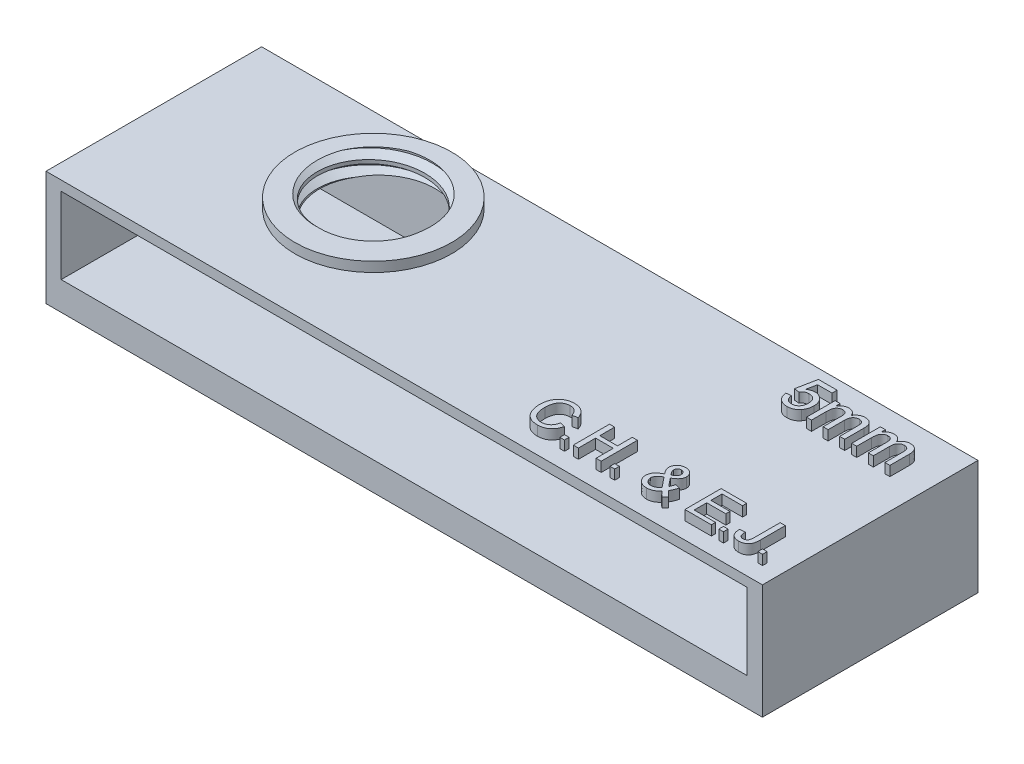
from build123d import *

# Parameters (mm, degrees)
SKIZZE1_W                       = 73.1
SKIZZE1_H                       = 22
BASIS_DEPTH                     = 11.7
SKIZZE2_W                       = 70
SKIZZE2_H                       = 7.8
HANDYSCHLITZ_DEPTH              = 21.25
SKIZZE3_R                       = 6.3
ZYLINDER_DEPTH                  = 1
SKIZZE6_R                       = 8
AUFSATZ_LINEAR_AUSTRAGEN1_DEPTH = 1
SKIZZE8_R                       = 6.3
SCHNITT_LINEAR_AUSTRAGEN2_DEPTH = 6
GEWINDE2_PITCH                  = 1.5
SKIZZE12_R                      = 7.5
SCHNITT_LINEAR_AUSTRAGEN5_DEPTH = 6
SKIZZE17_W                      = 30.300932881
SKIZZE17_H                      = 16.269400137
SCHNITT_LINEAR_AUSTRAGEN7_DEPTH = 6
EAH_JENA_DEPTH                  = 1
LOGO_DEPTH                      = 1
SKIZZE26_W                      = 0.474358974
SKIZZE26_H                      = 0.474358974
SKIZZE26_W_2                    = 0.474358975
C_H_E_J_DEPTH                   = 1
F_5MM_DEPTH                     = 1


with BuildPart() as part:
    # Skizze1 → Basis (new body)
    with BuildSketch(Plane(origin=(0, 0, 0), x_dir=(1, 0, 0), z_dir=(0, 1, 0))):
        with Locations((-9.866464149, 7.203333333)):
            Rectangle(SKIZZE1_W, SKIZZE1_H)
    extrude(amount=BASIS_DEPTH)

    # Skizze2 → Handyschlitz (cut)
    with BuildSketch(Plane.XY.offset(3.796666667)):
        with Locations((-9.866464149, 6.8)):
            Rectangle(SKIZZE2_W, SKIZZE2_H)
    extrude(amount=-HANDYSCHLITZ_DEPTH, mode=Mode.SUBTRACT)

    # Skizze3 → Zylinder (add)
    with BuildSketch(Plane(origin=(0, 11.7, 0), x_dir=(1, 0, 0), z_dir=(0, 1, 0))):
        with Locations(Location((-26.416464149, 9.603333333, 0), (0, 0, 270))):
            Circle(SKIZZE3_R)
    extrude(amount=ZYLINDER_DEPTH)

    # Skizze6 → Aufsatz-Linear austragen1 (add)
    with BuildSketch(Plane(origin=(0, 11.7, 0), x_dir=(1, 0, 0), z_dir=(0, 1, 0))):
        with Locations(Location((-26.416464149, 9.603333333, 0), (0, 0, 270))):
            Circle(SKIZZE6_R)
    extrude(amount=AUFSATZ_LINEAR_AUSTRAGEN1_DEPTH)

    # Skizze8 → Schnitt-Linear austragen2 (cut)
    with BuildSketch(Plane(origin=(0, 12.7, 0), x_dir=(1, 0, 0), z_dir=(0, 1, 0))):
        with Locations(Location((-26.416464149, 9.603333333, 0), (0, 0, 270))):
            Circle(SKIZZE8_R)
    extrude(amount=-SCHNITT_LINEAR_AUSTRAGEN2_DEPTH, mode=Mode.SUBTRACT)

    # Gewinde2: the profile of Gewindeprofil2 profile screwed along a right-hand helix of 5.333333 turns, 8 arcs to a turn; built about Z, then put on its axis
    gewinde2_z = Axis((0, 0, 0), (0, 0, 1))
    gewinde2_corners = [(6.3003, 0, -0.000173205), (6.3003, 0, 1.312673201), (5.488101187, 0, 0.843749998), (5.488101187, 0, 0.468749998)]
    with BuildLine(mode=Mode.PRIVATE) as gewinde2_profile:
        Line(gewinde2_corners[0], gewinde2_corners[1])
        Line(gewinde2_corners[1], gewinde2_corners[2])
        Line(gewinde2_corners[2], gewinde2_corners[3])
        Line(gewinde2_corners[3], gewinde2_corners[0])
    gewinde2_cap = Face(gewinde2_profile.wire())
    gewinde2_turn_angles = [0, 22.5, 45, 67.5, 90, 112.5, 135, 157.5, 180, 202.5, 225, 247.5, 270, 292.5, 315, 337.5, 360]
    gewinde2_turn_weights = [1, 0.9238795325112867, 1, 0.9238795325112867, 1, 0.9238795325112867, 1, 0.9238795325112867, 1, 0.9238795325112867, 1, 0.9238795325112867, 1, 0.9238795325112867, 1, 0.9238795325112867, 1]
    gewinde2_turn_rails = [Edge.make_bspline([Vector(p[0], p[1], 0).rotate(gewinde2_z, gewinde2_turn_angles[k]) / gewinde2_turn_weights[k] + Vector(0, 0, p[2] + GEWINDE2_PITCH * gewinde2_turn_angles[k] / 360) for k in range(17)], [0, 0, 0, 1, 1, 2, 2, 3, 3, 4, 4, 5, 5, 6, 6, 7, 7, 8, 8, 8], 2, gewinde2_turn_weights) for p in gewinde2_corners]
    gewinde2_turn_sides = [Face.make_surface_from_curves(gewinde2_turn_rails[p[0]], gewinde2_turn_rails[p[1]]) for p in [(0, 1), (1, 2), (2, 3), (3, 0)]]
    gewinde2_last_angles = [1800, 1822.5, 1845, 1867.5, 1890, 1905, 1920]
    gewinde2_last_weights = [1, 0.9238795325112867, 1, 0.9238795325112867, 1, 0.9659258262890688, 1]
    gewinde2_last_rails = [Edge.make_bspline([Vector(p[0], p[1], 0).rotate(gewinde2_z, gewinde2_last_angles[k]) / gewinde2_last_weights[k] + Vector(0, 0, p[2] + GEWINDE2_PITCH * gewinde2_last_angles[k] / 360) for k in range(7)], [0, 0, 0, 1, 1, 2, 2, 3, 3, 3], 2, gewinde2_last_weights) for p in gewinde2_corners]
    gewinde2_last_sides = [Face.make_surface_from_curves(gewinde2_last_rails[p[0]], gewinde2_last_rails[p[1]]) for p in [(0, 1), (1, 2), (2, 3), (3, 0)]]
    gewinde2 = Plane(origin=(-26.416464149, 14.3, -9.603333333), x_dir=(-1, 0, 0), z_dir=(0, -1, 0)) * Solid(Shell([*[p.moved(Location((0, 0, GEWINDE2_PITCH * i))) for i in range(5) for p in gewinde2_turn_sides], *gewinde2_last_sides, gewinde2_cap, gewinde2_cap.rotate(gewinde2_z, 1920).moved(Location((0, 0, GEWINDE2_PITCH * 1920 / 360)))]))
    add(gewinde2)

    # Skizze12 → Schnitt-Linear austragen5 (cut)
    with BuildSketch(Plane(origin=(0, 12.7, 0), x_dir=(1, 0, 0), z_dir=(0, 1, 0))):
        with Locations((-26.416464149, 9.603333333)):
            Circle(SKIZZE12_R)
    extrude(amount=SCHNITT_LINEAR_AUSTRAGEN5_DEPTH, mode=Mode.SUBTRACT)

    # Skizze17 → Schnitt-Linear austragen7 (cut)
    with BuildSketch(Plane(origin=(0, 10.7, 0), x_dir=(-1, 0, 0), z_dir=(0, -1, 0))):
        with Locations((28.531838804, 8.134700069)):
            Rectangle(SKIZZE17_W, SKIZZE17_H)
    extrude(amount=SCHNITT_LINEAR_AUSTRAGEN7_DEPTH, mode=Mode.SUBTRACT)

    # Skizze25 → EAH Jena (add)
    # profile 1 of 7: a face of its own
    with BuildSketch(Plane(origin=(0, 0, 0), x_dir=(-1, 0, 0), z_dir=(0, -1, 0))):
        Polygon((6.791710178, -1.663041856), (6.791710178, 1.836958144), (9.259658895, 1.836958144), (9.259658895, 1.43311199), (7.285299921, 1.43311199), (7.285299921, 0.356188913), (9.125043511, 0.356188913), (9.125043511, -0.047657241), (7.285299921, -0.047657241), (7.285299921, -1.259195702), (9.349402485, -1.259195702), (9.349402485, -1.663041856), align=None)
    # profile 2 of 7: a face of its own
    with BuildSketch(Plane(origin=(0, 0, 0), x_dir=(-1, 0, 0), z_dir=(0, -1, 0))):
        Polygon((9.543613222, -1.663041856), (10.93323662, 1.836958144), (11.489927325, 1.836958144), (12.879550722, -1.663041856), (12.355812742, -1.663041856), (11.957575562, -0.586118779), (10.465588383, -0.586118779), (10.067351203, -1.663041856), align=None)
        with BuildLine():
            Line((10.614226203, -0.182272625), (11.808937742, -0.182272625))
            Line((11.808937742, -0.182272625), (11.468893671, 0.737599169))
            add(Edge.make_bspline(
                [(11.468893671, 0.737599169), (11.455857596, 0.773141762), (11.430369606, 0.842634241), (11.392359336, 0.943600948), (11.357633765, 1.039483076), (11.323582491, 1.128905814), (11.292843798, 1.213168117), (11.264511156, 1.291700831), (11.236490413, 1.363958117), (11.219674771, 1.410643768), (11.211581972, 1.43311199)],
                knots=[0, 0, 0, 0, 1.225184869, 2.395467751, 3.491410812, 4.525364584, 5.492066482, 6.394148129, 7.227157926, 8, 8, 8, 8], degree=3))
            add(Edge.make_bspline(
                [(11.211581972, 1.43311199), (11.198194921, 1.377707334), (11.171365621, 1.266669571), (11.115191597, 1.103984353), (11.050930465, 0.942786964), (10.998742768, 0.838912467), (10.97249944, 0.786677695)],
                knots=[0, 0, 0, 0, 0.9891762, 1.982431084, 2.985436691, 4, 4, 4, 4], degree=3))
            Line((10.97249944, 0.786677695), (10.614226203, -0.182272625))
        make_face(mode=Mode.SUBTRACT)
    # profile 3 of 7: a face of its own
    with BuildSketch(Plane(origin=(0, 0, 0), x_dir=(-1, 0, 0), z_dir=(0, -1, 0))):
        Polygon((13.253248639, -1.663041856), (13.253248639, 1.836958144), (13.746838383, 1.836958144), (13.746838383, 0.401060708), (15.451966588, 0.401060708), (15.451966588, 1.836958144), (15.945556331, 1.836958144), (15.945556331, -1.663041856), (15.451966588, -1.663041856), (15.451966588, -0.002785446), (13.746838383, -0.002785446), (13.746838383, -1.663041856), align=None)
    # profile 4 of 7: a face of its own
    with BuildSketch(Plane(origin=(0, 0, 0), x_dir=(-1, 0, 0), z_dir=(0, -1, 0))):
        with BuildLine():
            Line((17.830171716, -0.686379196), (18.32376146, -0.630990574))
            add(Edge.make_bspline(
                [(18.32376146, -0.630990574), (18.325095054, -0.662092888), (18.327646186, -0.721590801), (18.336104163, -0.807008212), (18.347911279, -0.884697448), (18.36253253, -0.954942231), (18.379565969, -1.017791317), (18.400937234, -1.072737648), (18.423953924, -1.120935667), (18.452253265, -1.16088606), (18.482595025, -1.195029748), (18.515973611, -1.224020964), (18.55195843, -1.248725405), (18.590477759, -1.269133188), (18.631964985, -1.28478687), (18.67598885, -1.295660465), (18.722912253, -1.30318799), (18.755153505, -1.303768279), (18.771778286, -1.304067497)],
                knots=[0, 0, 0, 0, 1.632619403, 3.123158228, 4.499702462, 5.75227728, 6.885496867, 7.90993266, 8.841891104, 9.678429245, 10.468404694, 11.232957398, 11.991194639, 12.753385178, 13.513799276, 14.310593147, 15.128879333, 16, 16, 16, 16], degree=3))
            add(Edge.make_bspline(
                [(18.771778286, -1.304067497), (18.795948594, -1.303258637), (18.843177355, -1.301678124), (18.910921454, -1.28543416), (18.974042611, -1.261062533), (19.030755547, -1.22547634), (19.081319043, -1.182174894), (19.124329594, -1.131076481), (19.157092165, -1.072023015), (19.177726711, -1.017500544), (19.190384105, -0.968972917), (19.198667701, -0.926815945), (19.205651202, -0.879785295), (19.210925971, -0.827586205), (19.216281114, -0.770370123), (19.218420462, -0.70788694), (19.220914052, -0.64059173), (19.221100747, -0.594067985), (19.221197357, -0.569992978)],
                knots=[0, 0, 0, 0, 1.177507829, 2.300849353, 3.381033894, 4.466744326, 5.550475886, 6.619462111, 7.707386998, 8.830091395, 9.455333453, 10.153234525, 10.925888378, 11.774835866, 12.713513529, 13.729654905, 14.82514671, 16, 16, 16, 16], degree=3))
            Line((19.221197357, -0.569992978), (19.221197357, 1.836958144))
            Line((19.221197357, 1.836958144), (19.714787101, 1.836958144))
            Line((19.714787101, 1.836958144), (19.714787101, -0.538442497))
            add(Edge.make_bspline(
                [(19.714787101, -0.538442497), (19.714585465, -0.573971391), (19.714195247, -0.64272918), (19.709274699, -0.742842863), (19.70071679, -0.83682133), (19.689966548, -0.924870761), (19.675220284, -1.006805068), (19.656977905, -1.082350925), (19.636304717, -1.152121748), (19.603857092, -1.235394111), (19.554453955, -1.329868022), (19.478858362, -1.430064774), (19.387489561, -1.515539903), (19.281383393, -1.585889093), (19.163086158, -1.640180619), (19.034637285, -1.679598823), (18.896333766, -1.703992263), (18.800627436, -1.706582551), (18.751445754, -1.707913651)],
                knots=[0, 0, 0, 0, 0.979376435, 1.895351937, 2.762129694, 3.580429744, 4.339931879, 5.055623694, 5.722093767, 6.344240595, 7.517202841, 8.648554164, 9.788057829, 10.949533591, 12.142879013, 13.363546981, 14.645176409, 16, 16, 16, 16], degree=3))
            add(Edge.make_bspline(
                [(18.751445754, -1.707913651), (18.714948055, -1.707116316), (18.643854654, -1.705563197), (18.540496883, -1.693216986), (18.443373338, -1.674648981), (18.353691663, -1.644782191), (18.269632392, -1.609837507), (18.192822629, -1.564925889), (18.121947614, -1.513107367), (18.058801793, -1.452160372), (18.0018615, -1.384064763), (17.954778148, -1.306698621), (17.913168703, -1.222861112), (17.88175556, -1.130217094), (17.855988431, -1.03048475), (17.840050493, -0.922391611), (17.82958188, -0.80694885), (17.829971513, -0.727303214), (17.830171716, -0.686379196)],
                knots=[0, 0, 0, 0, 1.110149412, 2.162445788, 3.163771351, 4.112774839, 5.033433762, 5.928696445, 6.813333667, 7.698542325, 8.592646346, 9.506220098, 10.44759987, 11.434914499, 12.476633792, 13.577933972, 14.755478919, 16, 16, 16, 16], degree=3))
        make_face()
    # profile 5 of 7: a face of its own
    with BuildSketch(Plane(origin=(0, 0, 0), x_dir=(-1, 0, 0), z_dir=(0, -1, 0))):
        Polygon((20.522479408, -1.663041856), (20.522479408, 1.836958144), (22.990428126, 1.836958144), (22.990428126, 1.43311199), (21.016069152, 1.43311199), (21.016069152, 0.356188913), (22.855812742, 0.356188913), (22.855812742, -0.047657241), (21.016069152, -0.047657241), (21.016069152, -1.259195702), (23.080171716, -1.259195702), (23.080171716, -1.663041856), align=None)
    # profile 6 of 7: a face of its own
    with BuildSketch(Plane(origin=(0, 0, 0), x_dir=(-1, 0, 0), z_dir=(0, -1, 0))):
        Polygon((23.753248639, -1.663041856), (23.753248639, 1.836958144), (24.274883254, 1.836958144), (25.951966588, -0.774720542), (25.951966588, 1.836958144), (26.445556331, 1.836958144), (26.445556331, -1.663041856), (25.923921716, -1.663041856), (24.246838383, 0.94863683), (24.246838383, -1.663041856), align=None)
    # profile 7 of 7: a face of its own
    with BuildSketch(Plane(origin=(0, 0, 0), x_dir=(-1, 0, 0), z_dir=(0, -1, 0))):
        Polygon((26.774382453, -1.663041856), (28.164005851, 1.836958144), (28.720696556, 1.836958144), (30.110319953, -1.663041856), (29.586581972, -1.663041856), (29.188344793, -0.586118779), (27.696357613, -0.586118779), (27.298120434, -1.663041856), align=None)
        with BuildLine():
            Line((27.844995434, -0.182272625), (29.039706972, -0.182272625))
            Line((29.039706972, -0.182272625), (28.699662902, 0.737599169))
            add(Edge.make_bspline(
                [(28.699662902, 0.737599169), (28.686626826, 0.773141762), (28.661138837, 0.842634241), (28.623128566, 0.943600948), (28.588402995, 1.039483076), (28.554351722, 1.128905814), (28.523613028, 1.213168117), (28.495280387, 1.291700831), (28.467259644, 1.363958117), (28.450444002, 1.410643768), (28.442351203, 1.43311199)],
                knots=[0, 0, 0, 0, 1.225184869, 2.395467751, 3.491410812, 4.525364584, 5.492066482, 6.394148129, 7.227157926, 8, 8, 8, 8], degree=3))
            add(Edge.make_bspline(
                [(28.442351203, 1.43311199), (28.428964152, 1.377707334), (28.402134851, 1.266669571), (28.345960828, 1.103984353), (28.281699695, 0.942786964), (28.229511999, 0.838912467), (28.203268671, 0.786677695)],
                knots=[0, 0, 0, 0, 0.9891762, 1.982431084, 2.985436691, 4, 4, 4, 4], degree=3))
            Line((28.203268671, 0.786677695), (27.844995434, -0.182272625))
        make_face(mode=Mode.SUBTRACT)
    extrude(amount=EAH_JENA_DEPTH)

    # Skizze24 → LOGO (add)
    with BuildSketch(Plane(origin=(0, 0, 0), x_dir=(-1, 0, 0), z_dir=(0, -1, 0))):
        Polygon((33.761487263, 1.43405578), (32.029436456, -1.56594422), (35.493538071, -1.56594422), align=None)
        Polygon((35.947767039, -1.538115831), (37.679817846, 1.461884169), (34.215716231, 1.461884169), align=None)
        Polygon((38.093112145, 1.43405578), (36.361061337, -1.56594422), (39.825162952, -1.56594422), align=None)
        Polygon((40.238164925, -1.538115831), (41.970215732, 1.461884169), (38.506114117, 1.461884169), align=None)
        Polygon((42.342197995, 1.43405578), (40.610147188, -1.56594422), (44.074248803, -1.56594422), align=None)
        Polygon((35.947458768, 4.854602398), (34.21540796, 1.854602398), (37.679509575, 1.854602398), align=None)
        Polygon((38.133781063, 1.93405578), (39.865831871, 4.93405578), (36.401730256, 4.93405578), align=None)
        Polygon((40.279078334, 4.854602398), (38.547027526, 1.854602398), (42.011129142, 1.854602398), align=None)
        Polygon((38.133781063, 8.331557422), (36.401730256, 5.331557422), (39.865831871, 5.331557422), align=None)
    extrude(amount=LOGO_DEPTH)

    # Skizze26 → C.H. & E.J. (add)
    # profile 1 of 9: a face of its own
    with BuildSketch(Plane(origin=(0, 11.7, 0), x_dir=(1, 0, 0), z_dir=(0, 1, 0))):
        with BuildLine():
            Line((3.075711078, -0.786637436), (3.59750595, -0.908191923))
            add(Edge.make_bspline(
                [(3.59750595, -0.908191923), (3.584433532, -0.957098307), (3.55886226, -1.052765264), (3.508304748, -1.189675268), (3.451560142, -1.318159468), (3.38725156, -1.437879412), (3.31467515, -1.548146786), (3.235753894, -1.650378737), (3.147361833, -1.742431365), (3.052742176, -1.826429196), (2.951158207, -1.90051506), (2.843834679, -1.964489562), (2.731290373, -2.018918877), (2.613070418, -2.063678204), (2.489098172, -2.097363435), (2.36001197, -2.121915204), (2.225435405, -2.137037665), (2.133703404, -2.139028581), (2.086969091, -2.140042885)],
                knots=[0, 0, 0, 0, 1.145254194, 2.240259345, 3.299159039, 4.322497661, 5.312016644, 6.284080175, 7.241264552, 8.196044782, 9.144516039, 10.082428046, 11.020306713, 11.970622414, 12.939253955, 13.924100776, 14.94240044, 16, 16, 16, 16], degree=3))
            add(Edge.make_bspline(
                [(2.086969091, -2.140042885), (2.039018781, -2.139346253), (1.94520783, -2.137983348), (1.807780197, -2.126897844), (1.677073022, -2.107671761), (1.553330399, -2.080959872), (1.436135826, -2.04793228), (1.325975275, -2.006380644), (1.223041698, -1.956604773), (1.126476491, -1.899996744), (1.036689799, -1.835687473), (0.951639842, -1.765412494), (0.87339135, -1.687237213), (0.799987815, -1.603007422), (0.733027992, -1.511612013), (0.670048416, -1.41429263), (0.614123082, -1.309334511), (0.563179441, -1.198683581), (0.518465118, -1.083411141), (0.478908583, -0.965794139), (0.446568953, -0.84559821), (0.418726619, -0.723834783), (0.398500512, -0.599479303), (0.382441609, -0.473464815), (0.373612101, -0.345018742), (0.372450231, -0.25867823), (0.371864925, -0.215183109)],
                knots=[0, 0, 0, 0, 1.180702053, 2.309949215, 3.392367133, 4.431746864, 5.425408375, 6.388154007, 7.326956194, 8.237882283, 9.141054626, 10.043899035, 10.951650021, 11.86168169, 12.792564695, 13.739356664, 14.713891418, 15.718426911, 16.737522708, 17.757217648, 18.772674716, 19.801476837, 20.831699174, 21.873853055, 22.928926693, 24, 24, 24, 24], degree=3))
            add(Edge.make_bspline(
                [(0.371864925, -0.215183109), (0.372702036, -0.168228372), (0.374355958, -0.075457672), (0.383692318, 0.06142819), (0.400839828, 0.193539792), (0.424652732, 0.320964035), (0.454785582, 0.443804115), (0.491981207, 0.562119878), (0.535769084, 0.67575994), (0.58601572, 0.784849613), (0.643054943, 0.888171168), (0.705184366, 0.985871486), (0.773886016, 1.076346369), (0.847122989, 1.161324367), (0.926724428, 1.239390499), (1.012447266, 1.310721605), (1.103551922, 1.375968313), (1.200025099, 1.4345249), (1.30060578, 1.485905242), (1.403800018, 1.53167016), (1.51001826, 1.569180732), (1.618418379, 1.600369264), (1.729233749, 1.625198232), (1.842723303, 1.641801441), (1.958782175, 1.652621379), (2.03703813, 1.65408774), (2.076592489, 1.65482891)],
                knots=[0, 0, 0, 0, 1.185634383, 2.342514083, 3.462112933, 4.547331452, 5.613960142, 6.653690668, 7.676612054, 8.686959706, 9.683658101, 10.654407272, 11.607580201, 12.5494388, 13.484601218, 14.419076806, 15.362504069, 16.311442244, 17.265594461, 18.212500624, 19.159571152, 20.107257795, 21.059246075, 22.024387127, 23.001429356, 24, 24, 24, 24], degree=3))
            add(Edge.make_bspline(
                [(2.076592489, 1.65482891), (2.120848487, 1.653994707), (2.207838034, 1.652354997), (2.335479696, 1.638868059), (2.457727082, 1.616278916), (2.575109911, 1.586644097), (2.686407776, 1.54606786), (2.792829008, 1.497827378), (2.893314927, 1.439872282), (2.988647398, 1.373795284), (3.077274555, 1.299474522), (3.160436641, 1.218685498), (3.234742743, 1.129409076), (3.303135834, 1.033805905), (3.36346404, 0.930550295), (3.417946775, 0.820542524), (3.464800341, 0.70296481), (3.489869332, 0.62106868), (3.502634155, 0.579368173)],
                knots=[0, 0, 0, 0, 1.098391872, 2.158997981, 3.181470371, 4.182549255, 5.160268219, 6.118029851, 7.079534476, 8.035645336, 8.993622929, 9.94770573, 10.909620999, 11.872786677, 12.862530088, 13.874594564, 14.917769567, 16, 16, 16, 16], degree=3))
            Line((3.502634155, 0.579368173), (2.980839284, 0.467449103))
            add(Edge.make_bspline(
                [(2.980839284, 0.467449103), (2.970592047, 0.499452101), (2.950535034, 0.56209187), (2.914921845, 0.651364674), (2.876460789, 0.734239002), (2.834235691, 0.810151514), (2.78815504, 0.879120391), (2.739279953, 0.941983849), (2.68643943, 0.997568531), (2.630708291, 1.047156082), (2.570647397, 1.08939993), (2.507664833, 1.126834931), (2.440432615, 1.157806686), (2.369917927, 1.184002392), (2.295461675, 1.203940147), (2.217367056, 1.217967145), (2.135565453, 1.226085283), (2.079822255, 1.22729093), (2.051392168, 1.227905833)],
                knots=[0, 0, 0, 0, 1.235697765, 2.418642872, 3.532555292, 4.594392283, 5.610119701, 6.580908344, 7.519430642, 8.427315627, 9.319973334, 10.216139639, 11.118687699, 12.038725643, 12.980015607, 13.949697744, 14.954307006, 16, 16, 16, 16], degree=3))
            add(Edge.make_bspline(
                [(2.051392168, 1.227905833), (2.018751827, 1.227432254), (1.95455791, 1.226500864), (1.860249322, 1.216306904), (1.769680276, 1.201292196), (1.68352578, 1.17877635), (1.601314389, 1.150704945), (1.523533962, 1.115751079), (1.449522862, 1.074781048), (1.380107091, 1.027548822), (1.315870027, 0.97445071), (1.255068461, 0.918317697), (1.200621543, 0.856531869), (1.150453049, 0.791130549), (1.106023883, 0.720958047), (1.066030191, 0.646970199), (1.030726903, 0.568560616), (0.992243921, 0.458205066), (0.953005363, 0.316069671), (0.918965866, 0.142142015), (0.897283509, -0.034525858), (0.894870255, -0.15335589), (0.893659796, -0.212959551)],
                knots=[0, 0, 0, 0, 0.935256702, 1.839373932, 2.716087708, 3.564631604, 4.388828665, 5.203538865, 6.005592122, 6.810952829, 7.606223804, 8.392839071, 9.180346482, 9.963639178, 10.753404291, 11.558266631, 12.372976832, 13.215232055, 14.905983541, 16.594894834, 18.292041732, 20, 20, 20, 20], degree=3))
            add(Edge.make_bspline(
                [(0.893659796, -0.212959551), (0.895025022, -0.287901181), (0.897673682, -0.433294729), (0.923809451, -0.643993995), (0.963657015, -0.840519697), (1.011747284, -0.993848902), (1.059986656, -1.106947411), (1.099000236, -1.186151928), (1.143532681, -1.259443945), (1.192476307, -1.327239697), (1.246461559, -1.389341426), (1.304736313, -1.44607902), (1.367313587, -1.497998429), (1.434934863, -1.542669211), (1.504997313, -1.58233297), (1.576616805, -1.617602742), (1.649838432, -1.647432354), (1.724957612, -1.670604603), (1.800919471, -1.690628647), (1.87856065, -1.703709293), (1.95785901, -1.711091597), (2.011105897, -1.712438317), (2.038050822, -1.713119808)],
                knots=[0, 0, 0, 0, 2.10686522, 4.087509323, 5.961373225, 7.741398778, 8.594514555, 9.418024779, 10.222433421, 11.003575649, 11.767087398, 12.533660211, 13.289033706, 14.050297079, 14.809623433, 15.552362432, 16.294320901, 17.0305302, 17.761969017, 18.502233515, 19.242073914, 20, 20, 20, 20], degree=3))
            add(Edge.make_bspline(
                [(2.038050822, -1.713119808), (2.0702059, -1.712445448), (2.133723549, -1.711113349), (2.226848488, -1.699453415), (2.316619645, -1.682270975), (2.401949456, -1.655756737), (2.483985702, -1.623293158), (2.562056238, -1.583259887), (2.635915543, -1.535111548), (2.706432365, -1.480443631), (2.772306313, -1.418240883), (2.832676244, -1.34900444), (2.886834893, -1.272418663), (2.93705359, -1.189712643), (2.979246525, -1.098415644), (3.018327145, -1.001248829), (3.050891941, -0.896615174), (3.067319189, -0.823823297), (3.075711078, -0.786637436)],
                knots=[0, 0, 0, 0, 1.013374089, 2.001772144, 2.95501459, 3.891367103, 4.814208647, 5.733921849, 6.652182523, 7.590185968, 8.54346024, 9.504121027, 10.481158517, 11.497760682, 12.549996529, 13.647863555, 14.798406869, 16, 16, 16, 16], degree=3))
        make_face()
    # profile 2 of 9: a face of its own
    with BuildSketch(Plane(origin=(0, 11.7, 0), x_dir=(1, 0, 0), z_dir=(0, 1, 0))):
        with Locations((4.546223899, -1.8554275)):
            Rectangle(SKIZZE26_W, SKIZZE26_H)
    # profile 3 of 9: a face of its own
    with BuildSketch(Plane(origin=(0, 11.7, 0), x_dir=(1, 0, 0), z_dir=(0, 1, 0))):
        Polygon((5.684685437, -2.092606987), (5.684685437, 1.607393013), (6.206480309, 1.607393013), (6.206480309, 0.089444295), (8.009044412, 0.089444295), (8.009044412, 1.607393013), (8.530839284, 1.607393013), (8.530839284, -2.092606987), (8.009044412, -2.092606987), (8.009044412, -0.337478782), (6.206480309, -0.337478782), (6.206480309, -2.092606987), align=None)
    # profile 4 of 9: a face of its own
    with BuildSketch(Plane(origin=(0, 11.7, 0), x_dir=(1, 0, 0), z_dir=(0, 1, 0))):
        with Locations((9.669300822, -1.8554275)):
            Rectangle(SKIZZE26_W, SKIZZE26_H)
    # profile 5 of 9: a face of its own
    with BuildSketch(Plane(origin=(0, 11.7, 0), x_dir=(1, 0, 0), z_dir=(0, 1, 0))):
        with BuildLine():
            add(Edge.make_bspline(
                [(14.274288803, -1.623436314), (14.236749524, -1.664462929), (14.163257436, -1.744782311), (14.042552731, -1.849998573), (13.917470321, -1.940290358), (13.786477409, -2.013029645), (13.65060685, -2.070196079), (13.509204053, -2.110053588), (13.362562531, -2.135543554), (13.262675527, -2.138531887), (13.212169412, -2.140042885)],
                knots=[0, 0, 0, 0, 1.093164284, 2.140129739, 3.143504165, 4.122525029, 5.081066102, 6.036361366, 7.007120508, 8, 8, 8, 8], degree=3))
            add(Edge.make_bspline(
                [(13.212169412, -2.140042885), (13.165909178, -2.138970887), (13.075747117, -2.136881543), (12.944142423, -2.118648824), (12.820070528, -2.088999846), (12.70258584, -2.048568671), (12.593263009, -1.994563428), (12.490632385, -1.929585812), (12.395281166, -1.852701131), (12.339129135, -1.792870963), (12.31088736, -1.762779263)],
                knots=[0, 0, 0, 0, 1.100470892, 2.144838377, 3.154486211, 4.132569556, 5.094958372, 6.049140531, 7.018811397, 8, 8, 8, 8], degree=3))
            add(Edge.make_bspline(
                [(12.31088736, -1.762779263), (12.289477049, -1.736907866), (12.247436665, -1.68610788), (12.19217435, -1.605403866), (12.145441194, -1.522609076), (12.107263764, -1.437246516), (12.077347802, -1.349730381), (12.056934742, -1.259754654), (12.043696914, -1.167750925), (12.041969577, -1.105640225), (12.041095694, -1.074217564)],
                knots=[0, 0, 0, 0, 1.065358646, 2.091893341, 3.099477229, 4.078716359, 5.055661193, 6.029485947, 7.003089712, 8, 8, 8, 8], degree=3))
            add(Edge.make_bspline(
                [(12.041095694, -1.074217564), (12.041925717, -1.046278276), (12.043561268, -0.991224234), (12.053039085, -0.909506261), (12.07071677, -0.830168624), (12.092965327, -0.752154885), (12.124100415, -0.676802044), (12.161200875, -0.603572428), (12.204195592, -0.531781021), (12.254957897, -0.462915758), (12.312438384, -0.396036572), (12.376168238, -0.330767612), (12.446806803, -0.26770639), (12.524049835, -0.207201318), (12.607357031, -0.148071855), (12.698043309, -0.092480772), (12.794426087, -0.036824502), (12.862373102, -0.003315148), (12.897165405, 0.013843333)],
                knots=[0, 0, 0, 0, 0.915018781, 1.803033897, 2.688392046, 3.574045808, 4.455848883, 5.353064954, 6.260398892, 7.19238917, 8.150553927, 9.145935903, 10.177161104, 11.248536403, 12.357283344, 13.520048458, 14.730139544, 16, 16, 16, 16], degree=3))
            add(Edge.make_bspline(
                [(12.897165405, 0.013843333), (12.878828843, 0.037271881), (12.843315936, 0.082646573), (12.792629914, 0.149226601), (12.747503283, 0.212832413), (12.707374794, 0.273398358), (12.670994297, 0.329902724), (12.639763392, 0.383277246), (12.613557189, 0.433251983), (12.58532489, 0.494556618), (12.557426586, 0.568639844), (12.533967855, 0.656315804), (12.517678602, 0.742319799), (12.516190461, 0.799428661), (12.515454668, 0.827665449)],
                knots=[0, 0, 0, 0, 1.168292938, 2.262664013, 3.285595573, 4.230065678, 5.115538581, 5.924229713, 6.657599296, 7.330460229, 8.573844772, 9.760007627, 10.892462829, 12, 12, 12, 12], degree=3))
            add(Edge.make_bspline(
                [(12.515454668, 0.827665449), (12.515999697, 0.855148108), (12.517076164, 0.909428167), (12.530712954, 0.989259715), (12.550116851, 1.066467721), (12.578821457, 1.140704442), (12.615600906, 1.211880344), (12.658904777, 1.281467523), (12.712651576, 1.346424898), (12.771869745, 1.409413939), (12.838159123, 1.466432021), (12.908675732, 1.517531698), (12.984223945, 1.559786868), (13.063554666, 1.594834184), (13.147360006, 1.621544052), (13.235198652, 1.640653924), (13.327198169, 1.652983169), (13.390014149, 1.654207131), (13.421925021, 1.65482891)],
                knots=[0, 0, 0, 0, 0.964773243, 1.905490621, 2.838442154, 3.759192401, 4.695048573, 5.651344959, 6.633121115, 7.65260708, 8.686704549, 9.701112235, 10.708097826, 11.722839901, 12.744320586, 13.793472898, 14.87907178, 16, 16, 16, 16], degree=3))
            add(Edge.make_bspline(
                [(13.421925021, 1.65482891), (13.452355984, 1.654180163), (13.511946312, 1.652909777), (13.599133261, 1.64108179), (13.682581898, 1.624097802), (13.761224985, 1.597498135), (13.836243251, 1.56529829), (13.905924122, 1.52369866), (13.972409268, 1.476436572), (14.03342516, 1.421655335), (14.088456747, 1.362106756), (14.137285921, 1.299254837), (14.179036211, 1.233484942), (14.212473088, 1.163966775), (14.238468897, 1.091913167), (14.257169079, 1.016946238), (14.268516647, 0.938945277), (14.269887656, 0.885763085), (14.270582873, 0.858795256)],
                knots=[0, 0, 0, 0, 1.123791971, 2.200624789, 3.246281673, 4.265339271, 5.262698678, 6.256919688, 7.25765751, 8.27278209, 9.280532237, 10.250139998, 11.210073034, 12.153234139, 13.094626374, 14.035620154, 15.003894765, 16, 16, 16, 16], degree=3))
            add(Edge.make_bspline(
                [(14.270582873, 0.858795256), (14.269935309, 0.836788964), (14.268650337, 0.793121503), (14.260689256, 0.727958982), (14.24531569, 0.664757115), (14.226239554, 0.601961551), (14.200181378, 0.541124204), (14.168740895, 0.48112177), (14.131407585, 0.422493092), (14.088717368, 0.364872489), (14.039577462, 0.308960936), (13.986112383, 0.25324645), (13.925329983, 0.200265421), (13.860265405, 0.147225907), (13.788649354, 0.096263673), (13.711789133, 0.046021213), (13.629337767, -0.003218383), (13.571546534, -0.03361519), (13.541997136, -0.049157468)],
                knots=[0, 0, 0, 0, 0.861148472, 1.70879154, 2.562256628, 3.402982304, 4.273679903, 5.147056083, 6.050768824, 6.990318587, 7.949648442, 8.961312249, 10.008866095, 11.101815886, 12.244580615, 13.445664923, 14.693935717, 16, 16, 16, 16], degree=3))
            Line((13.541997136, -0.049157468), (14.209064444, -0.880026859))
            add(Edge.make_bspline(
                [(14.209064444, -0.880026859), (14.230571539, -0.84235794), (14.274424164, -0.765551615), (14.327092613, -0.640906926), (14.375544007, -0.508850469), (14.400263385, -0.416516116), (14.412890566, -0.369349776)],
                knots=[0, 0, 0, 0, 0.942661657, 1.922072078, 2.938550464, 4, 4, 4, 4], degree=3))
            Line((14.412890566, -0.369349776), (14.88724954, -0.469409872))
            add(Edge.make_bspline(
                [(14.88724954, -0.469409872), (14.877098835, -0.508259612), (14.857166937, -0.584544863), (14.823943065, -0.695924622), (14.787482461, -0.801602304), (14.749546523, -0.90222729), (14.706541498, -0.996056931), (14.663405396, -1.085377158), (14.616649183, -1.168820528), (14.582421651, -1.2211549), (14.56557486, -1.246913878)],
                knots=[0, 0, 0, 0, 1.139557996, 2.237633175, 3.297547274, 4.31192991, 5.288002333, 6.225615005, 7.126647716, 8, 8, 8, 8], degree=3))
            add(Edge.make_bspline(
                [(14.56557486, -1.246913878), (14.607251166, -1.299744242), (14.689645978, -1.404190831), (14.826294256, -1.547144108), (14.970017721, -1.678144449), (15.073120205, -1.754947128), (15.124429027, -1.793167885)],
                knots=[0, 0, 0, 0, 1.028924747, 2.034202902, 3.021723538, 4, 4, 4, 4], degree=3))
            Line((15.124429027, -1.793167885), (14.792377745, -2.140042885))
            add(Edge.make_bspline(
                [(14.792377745, -2.140042885), (14.749491966, -2.108207335), (14.659824316, -2.041644034), (14.532041213, -1.921011276), (14.401591687, -1.780896688), (14.317876627, -1.677349901), (14.274288803, -1.623436314)],
                knots=[0, 0, 0, 0, 0.872411164, 1.824079249, 2.867065851, 4, 4, 4, 4], degree=3))
        make_face()
        with BuildLine():
            add(Edge.make_bspline(
                [(13.309264764, 0.240646218), (13.333827441, 0.254304185), (13.380871005, 0.28046255), (13.447058184, 0.320995583), (13.507025329, 0.358952122), (13.560114785, 0.396409477), (13.606677056, 0.432171885), (13.646159132, 0.467226462), (13.679385318, 0.500477087), (13.713504583, 0.543532715), (13.746095249, 0.598820132), (13.776107232, 0.667197544), (13.792505746, 0.739940564), (13.794972876, 0.78929675), (13.796223899, 0.814324103)],
                knots=[0, 0, 0, 0, 1.271792556, 2.43579536, 3.512067756, 4.483055973, 5.375475791, 6.167548077, 6.871271346, 7.499925424, 8.648574742, 9.765884326, 10.867132895, 12, 12, 12, 12], degree=3))
            add(Edge.make_bspline(
                [(13.796223899, 0.814324103), (13.794715288, 0.843329515), (13.791785731, 0.899654829), (13.771552067, 0.980520956), (13.733476921, 1.05160152), (13.684297299, 1.114106482), (13.623324101, 1.164298592), (13.554590072, 1.201772573), (13.478086831, 1.223737842), (13.424782445, 1.226493605), (13.397465886, 1.227905833)],
                knots=[0, 0, 0, 0, 1.083649433, 2.1043278, 3.082572745, 4.07413364, 5.057198304, 6.010979397, 6.980699265, 8, 8, 8, 8], degree=3))
            add(Edge.make_bspline(
                [(13.397465886, 1.227905833), (13.369423625, 1.226441572), (13.314996208, 1.223599577), (13.236445284, 1.202540501), (13.166092635, 1.16550245), (13.104627676, 1.115479154), (13.053313864, 1.056112989), (13.016175574, 0.987928924), (12.994010458, 0.913024005), (12.991231519, 0.860920497), (12.989813643, 0.834336122)],
                knots=[0, 0, 0, 0, 1.064732527, 2.066546696, 3.061478495, 4.062632954, 5.061320643, 6.023117715, 6.99135042, 8, 8, 8, 8], degree=3))
            add(Edge.make_bspline(
                [(12.989813643, 0.834336122), (12.991918215, 0.805728755), (12.99630634, 0.746081167), (13.02619716, 0.655433104), (13.073626816, 0.5607076), (13.116199101, 0.499297801), (13.138792008, 0.466707917)],
                knots=[0, 0, 0, 0, 0.851934298, 1.7763196, 2.819903515, 4, 4, 4, 4], degree=3))
            Line((13.138792008, 0.466707917), (13.309264764, 0.240646218))
        make_face(mode=Mode.SUBTRACT)
        with BuildLine():
            Line((13.954096495, -1.305467564), (13.132121335, -0.278925096))
            add(Edge.make_bspline(
                [(13.132121335, -0.278925096), (13.102844851, -0.296266852), (13.04650175, -0.329641364), (12.966785233, -0.381253193), (12.894138725, -0.43106158), (12.829338724, -0.481124299), (12.771695791, -0.529814489), (12.720777743, -0.576920488), (12.678232706, -0.624081771), (12.63178135, -0.683971157), (12.585810052, -0.758693664), (12.54591469, -0.849187756), (12.520463988, -0.93942725), (12.517107569, -0.999944244), (12.515454668, -1.02974641)],
                knots=[0, 0, 0, 0, 1.203568211, 2.316287951, 3.358764306, 4.318456418, 5.21144218, 6.027559373, 6.770070086, 7.455339289, 8.706942094, 9.861436946, 10.946844384, 12, 12, 12, 12], degree=3))
            add(Edge.make_bspline(
                [(12.515454668, -1.02974641), (12.517724661, -1.066299552), (12.522415188, -1.141829964), (12.558347756, -1.254717123), (12.614371403, -1.369200938), (12.676819772, -1.463049429), (12.73692697, -1.534970433), (12.788480857, -1.582748692), (12.84443564, -1.623203363), (12.905332099, -1.655993097), (12.970361628, -1.682174217), (13.040485294, -1.699608164), (13.114688615, -1.711182641), (13.165922499, -1.712463784), (13.192157393, -1.713119808)],
                knots=[0, 0, 0, 0, 1.234230147, 2.550311916, 3.969910911, 5.53595692, 6.347722212, 7.133813204, 7.90575376, 8.675703375, 9.466748957, 10.269004423, 11.113624024, 12, 12, 12, 12], degree=3))
            add(Edge.make_bspline(
                [(13.192157393, -1.713119808), (13.226093132, -1.71150209), (13.295300667, -1.708202964), (13.399618669, -1.686849876), (13.504950957, -1.650228482), (13.61020497, -1.601368375), (13.710771751, -1.540552902), (13.803701515, -1.471696765), (13.885503685, -1.393485537), (13.931303705, -1.334715166), (13.954096495, -1.305467564)],
                knots=[0, 0, 0, 0, 0.911790577, 1.859478536, 2.848146299, 3.902378421, 4.971302936, 6.000153631, 7.004758516, 8, 8, 8, 8], degree=3))
        make_face(mode=Mode.SUBTRACT)
    # profile 6 of 9: a face of its own
    with BuildSketch(Plane(origin=(0, 11.7, 0), x_dir=(1, 0, 0), z_dir=(0, 1, 0))):
        Polygon((17.069300822, -2.092606987), (17.069300822, 1.607393013), (19.678275181, 1.607393013), (19.678275181, 1.180469936), (17.591095694, 1.180469936), (17.591095694, 0.042008397), (19.535967489, 0.042008397), (19.535967489, -0.38491468), (17.591095694, -0.38491468), (17.591095694, -1.66568391), (19.773146976, -1.66568391), (19.773146976, -2.092606987), align=None)
    # profile 7 of 9: a face of its own
    with BuildSketch(Plane(origin=(0, 11.7, 0), x_dir=(1, 0, 0), z_dir=(0, 1, 0))):
        with Locations((20.769300822, -1.8554275)):
            Rectangle(SKIZZE26_W, SKIZZE26_H)
    # profile 8 of 9: a face of its own
    with BuildSketch(Plane(origin=(0, 11.7, 0), x_dir=(1, 0, 0), z_dir=(0, 1, 0))):
        with BuildLine():
            Line((21.623146976, -1.060135032), (22.144941848, -1.001581346))
            add(Edge.make_bspline(
                [(22.144941848, -1.001581346), (22.146351648, -1.034460935), (22.149048558, -1.097358728), (22.157989849, -1.187657134), (22.170471657, -1.269785756), (22.185928408, -1.344044526), (22.203935186, -1.410484988), (22.226527666, -1.46857111), (22.250859596, -1.519523301), (22.280776042, -1.561756574), (22.312851616, -1.59785133), (22.34813755, -1.628499187), (22.386178645, -1.654615311), (22.426899079, -1.676189252), (22.470757003, -1.692737431), (22.517296518, -1.704232374), (22.566901258, -1.712190043), (22.600984867, -1.712803491), (22.618559636, -1.713119808)],
                knots=[0, 0, 0, 0, 1.632619403, 3.123158228, 4.499702462, 5.75227728, 6.885496867, 7.90993266, 8.841891104, 9.678429245, 10.468404694, 11.232957398, 11.991194639, 12.753385178, 13.513799276, 14.310593147, 15.128879333, 16, 16, 16, 16], degree=3))
            add(Edge.make_bspline(
                [(22.618559636, -1.713119808), (22.644111104, -1.712264727), (22.694038652, -1.710593899), (22.765653841, -1.693421709), (22.832381922, -1.667657417), (22.892335597, -1.630037727), (22.945788436, -1.584261913), (22.991256733, -1.530243591), (23.025891451, -1.467815641), (23.047705114, -1.4101776), (23.061085787, -1.358876966), (23.069842731, -1.314311024), (23.07722529, -1.264592909), (23.082801474, -1.209411013), (23.088462625, -1.14892544), (23.090724221, -1.08287179), (23.093360302, -1.011731139), (23.093557665, -0.962548895), (23.093659796, -0.937098173)],
                knots=[0, 0, 0, 0, 1.177507829, 2.300849353, 3.381033894, 4.466744326, 5.550475886, 6.619462111, 7.707386998, 8.830091395, 9.455333453, 10.153234525, 10.925888378, 11.774835866, 12.713513529, 13.729654905, 14.82514671, 16, 16, 16, 16], degree=3))
            Line((23.093659796, -0.937098173), (23.093659796, 1.607393013))
            Line((23.093659796, 1.607393013), (23.615454668, 1.607393013))
            Line((23.615454668, 1.607393013), (23.615454668, -0.903744808))
            add(Edge.make_bspline(
                [(23.615454668, -0.903744808), (23.615241511, -0.941303924), (23.614828994, -1.013990729), (23.609627272, -1.119825195), (23.60058034, -1.219173859), (23.589215799, -1.312254686), (23.573626891, -1.398870954), (23.55434209, -1.478733717), (23.532487577, -1.552491444), (23.498185802, -1.640522228), (23.445959628, -1.740394648), (23.366044288, -1.846316929), (23.269454412, -1.93667635), (23.157285034, -2.011045495), (23.032227957, -2.068439394), (22.896439149, -2.110110067), (22.750232571, -2.135897417), (22.649057309, -2.138635722), (22.597065245, -2.140042885)],
                knots=[0, 0, 0, 0, 0.979376435, 1.895351937, 2.762129694, 3.580429744, 4.339931879, 5.055623694, 5.722093767, 6.344240595, 7.517202841, 8.648554164, 9.788057829, 10.949533591, 12.142879013, 13.363546981, 14.645176409, 16, 16, 16, 16], degree=3))
            add(Edge.make_bspline(
                [(22.597065245, -2.140042885), (22.558481962, -2.139199988), (22.483326081, -2.137558119), (22.374062152, -2.12450641), (22.271388691, -2.104877376), (22.176582349, -2.073303912), (22.087719691, -2.03636239), (22.006520798, -1.988884393), (21.931595782, -1.934104813), (21.864841629, -1.869675133), (21.804647605, -1.797688345), (21.754873775, -1.715901281), (21.710886648, -1.627273058), (21.677678468, -1.529335096), (21.650438932, -1.423903761), (21.633590254, -1.309633871), (21.622523435, -1.18759438), (21.622935332, -1.103397565), (21.623146976, -1.060135032)],
                knots=[0, 0, 0, 0, 1.110149412, 2.162445788, 3.163771351, 4.112774839, 5.033433762, 5.928696445, 6.813333667, 7.698542325, 8.592646346, 9.506220098, 10.44759987, 11.434914499, 12.476633792, 13.577933972, 14.755478919, 16, 16, 16, 16], degree=3))
        make_face()
    # profile 9 of 9: a face of its own
    with BuildSketch(Plane(origin=(0, 11.7, 0), x_dir=(1, 0, 0), z_dir=(0, 1, 0))):
        with Locations((24.753916207, -1.8554275)):
            Rectangle(SKIZZE26_W_2, SKIZZE26_H)
    extrude(amount=C_H_E_J_DEPTH)

    # Skizze27 → 5mm (add)
    with BuildSketch(Plane(origin=(0, 11.7, 0), x_dir=(1, 0, 0), z_dir=(0, 1, 0))):
        with BuildLine():
            Line((11.930883678, 13.344941137), (12.443704191, 13.396223188))
            add(Edge.make_bspline(
                [(12.443704191, 13.396223188), (12.448781919, 13.367328566), (12.45865889, 13.311124034), (12.47748055, 13.229766306), (12.501924528, 13.154182703), (12.529390029, 13.083718627), (12.562037411, 13.019119148), (12.597411119, 12.959364274), (12.639127178, 12.906575117), (12.682986014, 12.857990753), (12.731124437, 12.815179336), (12.784006948, 12.779087835), (12.840158089, 12.747600186), (12.900261761, 12.721819498), (12.96441008, 12.702949392), (13.031786608, 12.688026377), (13.10325894, 12.68050674), (13.152024025, 12.679028075), (13.176877268, 12.67827447)],
                knots=[0, 0, 0, 0, 1.237781394, 2.407677316, 3.51963579, 4.58689595, 5.594855907, 6.570874, 7.510833816, 8.428091223, 9.330271693, 10.221190844, 11.124215526, 12.043132878, 12.973586933, 13.941700858, 14.950982896, 16, 16, 16, 16], degree=3))
            add(Edge.make_bspline(
                [(13.176877268, 12.67827447), (13.207366629, 12.679011181), (13.266989902, 12.680451853), (13.353730471, 12.692636472), (13.435663964, 12.712727499), (13.51239834, 12.740843397), (13.584833163, 12.775808844), (13.65056545, 12.821082728), (13.713179289, 12.871975048), (13.768645464, 12.93264846), (13.819135267, 12.998701604), (13.862711763, 13.07080142), (13.899397016, 13.14793593), (13.930281989, 13.230090348), (13.953088288, 13.317733991), (13.969864163, 13.410400612), (13.980633605, 13.508149241), (13.981647779, 13.575147461), (13.982165729, 13.609364214)],
                knots=[0, 0, 0, 0, 1.052816602, 2.058828735, 3.018813999, 3.961574988, 4.877590722, 5.788574389, 6.712363302, 7.658909047, 8.620312049, 9.580784896, 10.562948504, 11.56722449, 12.607883026, 13.686460295, 14.818448981, 16, 16, 16, 16], degree=3))
            add(Edge.make_bspline(
                [(13.982165729, 13.609364214), (13.981577036, 13.641972333), (13.980430712, 13.705467903), (13.970776802, 13.797928012), (13.954489518, 13.884868494), (13.933415297, 13.967247588), (13.904367142, 14.043778016), (13.869914395, 14.115569397), (13.827708332, 14.181098106), (13.780751301, 14.242404468), (13.727120444, 14.297363152), (13.666091216, 14.343768799), (13.600057758, 14.384383113), (13.527690089, 14.417318787), (13.448945595, 14.441788755), (13.364606779, 14.460616194), (13.273798501, 14.470518656), (13.211352913, 14.47225466), (13.179281114, 14.473146265)],
                knots=[0, 0, 0, 0, 1.165854935, 2.270189951, 3.319242023, 4.32700288, 5.306253956, 6.24172124, 7.169108591, 8.088047231, 8.999810445, 9.905349262, 10.822648491, 11.767237767, 12.739852311, 13.766490849, 14.852878837, 16, 16, 16, 16], degree=3))
            add(Edge.make_bspline(
                [(13.179281114, 14.473146265), (13.139401388, 14.471979705), (13.0629211, 14.469742507), (12.95302679, 14.450921763), (12.852986021, 14.420519249), (12.76393145, 14.375208), (12.684365593, 14.32107627), (12.612635509, 14.259823762), (12.548149713, 14.191491889), (12.512776628, 14.140045919), (12.494986242, 14.114171906)],
                knots=[0, 0, 0, 0, 1.182877094, 2.268490576, 3.298955169, 4.273890847, 5.221533034, 6.149304476, 7.069219215, 8, 8, 8, 8], degree=3))
            Line((12.494986242, 14.114171906), (11.982165729, 14.165453957))
            Line((11.982165729, 14.165453957), (12.392422139, 16.216736008))
            Line((12.392422139, 16.216736008), (14.289858037, 16.216736008))
            Line((14.289858037, 16.216736008), (14.289858037, 15.703915496))
            Line((14.289858037, 15.703915496), (12.811492652, 15.703915496))
            Line((12.811492652, 15.703915496), (12.607967011, 14.667857803))
            add(Edge.make_bspline(
                [(12.607967011, 14.667857803), (12.636263074, 14.689091565), (12.691832065, 14.730791315), (12.77850973, 14.78539164), (12.866426795, 14.831416074), (12.955071472, 14.869106215), (13.045147904, 14.898466768), (13.136112527, 14.918865125), (13.228275063, 14.932651535), (13.290075478, 14.934005063), (13.321108037, 14.934684726)],
                knots=[0, 0, 0, 0, 1.093835215, 2.148119334, 3.164235237, 4.159999629, 5.123971815, 6.089888814, 7.040853737, 8, 8, 8, 8], degree=3))
            add(Edge.make_bspline(
                [(13.321108037, 14.934684726), (13.361494809, 14.933626561), (13.441026157, 14.931542777), (13.558218352, 14.914421864), (13.670273805, 14.885357979), (13.778071469, 14.846213165), (13.880189905, 14.794320025), (13.977663501, 14.731488453), (14.070098721, 14.657200544), (14.156973003, 14.572857957), (14.235771431, 14.47922882), (14.306298596, 14.379366717), (14.363901333, 14.271272685), (14.412349187, 14.157769077), (14.448889597, 14.03699269), (14.476625043, 13.910657588), (14.491454265, 13.777184293), (14.49379049, 13.68632005), (14.494986242, 13.639812931)],
                knots=[0, 0, 0, 0, 0.991958705, 1.953407265, 2.902004973, 3.832128134, 4.765371166, 5.71007953, 6.676509202, 7.674246545, 8.68000108, 9.679398714, 10.671856529, 11.683459888, 12.706765812, 13.76733029, 14.85725088, 16, 16, 16, 16], degree=3))
            add(Edge.make_bspline(
                [(14.494986242, 13.639812931), (14.494078244, 13.595437495), (14.492284689, 13.507783345), (14.477586133, 13.378608752), (14.453373756, 13.254138864), (14.420960063, 13.134005088), (14.377164815, 13.01888969), (14.324045279, 12.908420838), (14.262768914, 12.801445828), (14.213628449, 12.735501909), (14.188896498, 12.702312931)],
                knots=[0, 0, 0, 0, 1.059692978, 2.093196008, 3.100373587, 4.086253034, 5.061402885, 6.037282833, 7.012182238, 8, 8, 8, 8], degree=3))
            add(Edge.make_bspline(
                [(14.188896498, 12.702312931), (14.157475249, 12.66357095), (14.095666277, 12.587361313), (13.988644717, 12.488445766), (13.873595022, 12.404381164), (13.749832519, 12.336084767), (13.618188064, 12.281202829), (13.477044442, 12.24468096), (13.32810713, 12.220155078), (13.225858776, 12.21789138), (13.173672139, 12.216736008)],
                knots=[0, 0, 0, 0, 1.023140956, 2.012628108, 2.982342558, 3.942221589, 4.908720554, 5.902469194, 6.929439212, 8, 8, 8, 8], degree=3))
            add(Edge.make_bspline(
                [(13.173672139, 12.216736008), (13.130626444, 12.217609183), (13.046420422, 12.219317289), (12.923127825, 12.234166748), (12.805861985, 12.2578464), (12.694586166, 12.291810351), (12.588965123, 12.334726981), (12.490226563, 12.389245818), (12.396656985, 12.451611972), (12.310314607, 12.523746932), (12.23164546, 12.604205144), (12.161156305, 12.691281873), (12.099801055, 12.785033898), (12.047609322, 12.884900229), (12.004109923, 12.990785091), (11.970831162, 13.103411188), (11.944471615, 13.221673485), (11.935460481, 13.303421089), (11.930883678, 13.344941137)],
                knots=[0, 0, 0, 0, 1.108768375, 2.168973506, 3.19473529, 4.187459816, 5.162590879, 6.12651078, 7.088512529, 8.056012598, 9.019588496, 9.983680353, 10.938070192, 11.90157236, 12.88306954, 13.882379887, 14.924449348, 16, 16, 16, 16], degree=3))
        make_face()
        with BuildLine():
            Line((15.116781114, 12.26801806), (15.116781114, 15.191094983))
            Line((15.116781114, 15.191094983), (15.629601627, 15.191094983))
            Line((15.629601627, 15.191094983), (15.629601627, 14.735165496))
            add(Edge.make_bspline(
                [(15.629601627, 14.735165496), (15.652176725, 14.77214061), (15.696717319, 14.84509239), (15.779325474, 14.942562572), (15.870930641, 15.029723948), (15.97265467, 15.105469451), (16.084328455, 15.166751191), (16.204360593, 15.211133993), (16.332262026, 15.23738794), (16.41981018, 15.240690033), (16.464537524, 15.242377034)],
                knots=[0, 0, 0, 0, 1.012837134, 1.998324314, 2.98019487, 3.968118755, 4.958650973, 5.951725623, 6.953560186, 8, 8, 8, 8], degree=3))
            add(Edge.make_bspline(
                [(16.464537524, 15.242377034), (16.513288841, 15.240904635), (16.607084166, 15.238071805), (16.740684132, 15.210394773), (16.860740951, 15.165310297), (16.966937152, 15.102419804), (17.058096112, 15.022491147), (17.136515393, 14.929380854), (17.198824465, 14.820541849), (17.22723585, 14.740755739), (17.241781114, 14.699909085)],
                knots=[0, 0, 0, 0, 1.14260047, 2.198311542, 3.184080093, 4.139503782, 5.07683556, 6.015590709, 6.984077836, 8, 8, 8, 8], degree=3))
            add(Edge.make_bspline(
                [(17.241781114, 14.699909085), (17.270152551, 14.743130444), (17.325152797, 14.826918423), (17.421977464, 14.936753641), (17.522602558, 15.031980659), (17.631156026, 15.108856053), (17.746118508, 15.169116652), (17.86781676, 15.211711539), (17.996073219, 15.237130375), (18.083547135, 15.240609192), (18.127999063, 15.242377034)],
                knots=[0, 0, 0, 0, 1.138522562, 2.207114883, 3.219638414, 4.186902816, 5.129823568, 6.072192529, 7.02033929, 8, 8, 8, 8], degree=3))
            add(Edge.make_bspline(
                [(18.127999063, 15.242377034), (18.162487692, 15.241593115), (18.229782897, 15.24006351), (18.327587914, 15.228619464), (18.419510094, 15.210717049), (18.505010978, 15.183892761), (18.584613252, 15.15039418), (18.658327932, 15.109463463), (18.725046881, 15.060134936), (18.785869272, 15.003679814), (18.839710472, 14.938923036), (18.887394706, 14.866671572), (18.92658355, 14.785657375), (18.958309518, 14.696872926), (18.984377768, 14.600525875), (19.001094574, 14.495502982), (19.012987033, 14.382874855), (19.013799261, 14.304911584), (19.014217011, 14.264812931)],
                knots=[0, 0, 0, 0, 1.095882962, 2.138318376, 3.1255456, 4.06796008, 4.980856081, 5.866385201, 6.740777206, 7.611659656, 8.497473544, 9.411000816, 10.356316449, 11.349910013, 12.40416823, 13.523408539, 14.726220937, 16, 16, 16, 16], degree=3))
            Line((19.014217011, 14.264812931), (19.014217011, 12.26801806))
            Line((19.014217011, 12.26801806), (18.501396498, 12.26801806))
            Line((18.501396498, 12.26801806), (18.501396498, 14.075710367))
            add(Edge.make_bspline(
                [(18.501396498, 14.075710367), (18.500656205, 14.120849732), (18.499283788, 14.204532876), (18.492715129, 14.320123686), (18.477398698, 14.415191746), (18.458095917, 14.492972308), (18.429303221, 14.557261284), (18.392414198, 14.613239469), (18.34457271, 14.661908882), (18.28887766, 14.703874231), (18.226201089, 14.738647942), (18.157331583, 14.763700921), (18.0826696, 14.778242204), (18.031108672, 14.779957007), (18.004601627, 14.780838573)],
                knots=[0, 0, 0, 0, 1.637099343, 3.034992218, 4.192454477, 5.125064895, 5.931363659, 6.734457378, 7.542615046, 8.392902438, 9.255454751, 10.131653416, 11.039498489, 12, 12, 12, 12], degree=3))
            add(Edge.make_bspline(
                [(18.004601627, 14.780838573), (17.980523327, 14.780274442), (17.933236879, 14.779166569), (17.864133666, 14.768921654), (17.79778385, 14.75435818), (17.735236803, 14.731336109), (17.675293182, 14.703165843), (17.618307329, 14.668928603), (17.565092331, 14.627201953), (17.51458214, 14.580324217), (17.468206051, 14.526375691), (17.428806324, 14.463942961), (17.39647925, 14.393884162), (17.368795832, 14.316738138), (17.347607535, 14.232186273), (17.33239524, 14.140010372), (17.323809211, 14.040350495), (17.322558058, 13.971293125), (17.321909319, 13.935486008)],
                knots=[0, 0, 0, 0, 0.936978583, 1.840096209, 2.715540616, 3.577474171, 4.428863993, 5.292176944, 6.159677271, 7.057388756, 7.97228745, 8.921538631, 9.921836886, 10.971267826, 12.108934396, 13.31095831, 14.605698001, 16, 16, 16, 16], degree=3))
            Line((17.321909319, 13.935486008), (17.321909319, 12.26801806))
            Line((17.321909319, 12.26801806), (16.809088806, 12.26801806))
            Line((16.809088806, 12.26801806), (16.809088806, 14.132601393))
            add(Edge.make_bspline(
                [(16.809088806, 14.132601393), (16.808895154, 14.15879115), (16.808521189, 14.209366733), (16.802421109, 14.28287035), (16.794259376, 14.351496372), (16.781212641, 14.414867426), (16.76550749, 14.473200117), (16.745247183, 14.526139554), (16.722230967, 14.574744811), (16.694795186, 14.618304139), (16.663639243, 14.6571169), (16.627701157, 14.690485524), (16.587436339, 14.718879265), (16.54185893, 14.741239411), (16.492055945, 14.758767903), (16.437803207, 14.771501066), (16.379056533, 14.779811709), (16.33823216, 14.780488347), (16.317101627, 14.780838573)],
                knots=[0, 0, 0, 0, 1.345752242, 2.598810075, 3.789149697, 4.895786345, 5.921724826, 6.890687139, 7.805619527, 8.681717145, 9.530827886, 10.356528998, 11.194466742, 12.054057324, 12.95727461, 13.903003647, 14.914602983, 16, 16, 16, 16], degree=3))
            add(Edge.make_bspline(
                [(16.317101627, 14.780838573), (16.284392177, 14.779785772), (16.219617488, 14.777700905), (16.12502044, 14.755533225), (16.034063308, 14.721690526), (15.94794623, 14.674654672), (15.868734478, 14.614933328), (15.801350076, 14.540448031), (15.745939007, 14.453591361), (15.709317838, 14.372276243), (15.686118884, 14.300096222), (15.671166635, 14.239277186), (15.658444154, 14.172932063), (15.648251168, 14.100696296), (15.639080466, 14.023002398), (15.634235709, 13.939263617), (15.629523572, 13.850067619), (15.62957502, 13.78859203), (15.629601627, 13.756800111)],
                knots=[0, 0, 0, 0, 1.117976261, 2.213934112, 3.307715435, 4.433034498, 5.561469973, 6.68771744, 7.851930709, 9.075635627, 9.729167061, 10.44550689, 11.218440431, 12.040901402, 12.942650761, 13.89578902, 14.911813504, 16, 16, 16, 16], degree=3))
            Line((15.629601627, 13.756800111), (15.629601627, 12.26801806))
            Line((15.629601627, 12.26801806), (15.116781114, 12.26801806))
        make_face()
        with BuildLine():
            Line((19.732165729, 12.26801806), (19.732165729, 15.191094983))
            Line((19.732165729, 15.191094983), (20.244986242, 15.191094983))
            Line((20.244986242, 15.191094983), (20.244986242, 14.735165496))
            add(Edge.make_bspline(
                [(20.244986242, 14.735165496), (20.26756134, 14.77214061), (20.312101934, 14.84509239), (20.394710089, 14.942562572), (20.486315257, 15.029723948), (20.588039285, 15.105469451), (20.69971307, 15.166751191), (20.819745209, 15.211133993), (20.947646641, 15.23738794), (21.035194795, 15.240690033), (21.079922139, 15.242377034)],
                knots=[0, 0, 0, 0, 1.012837134, 1.998324314, 2.98019487, 3.968118755, 4.958650973, 5.951725623, 6.953560186, 8, 8, 8, 8], degree=3))
            add(Edge.make_bspline(
                [(21.079922139, 15.242377034), (21.128673456, 15.240904635), (21.222468782, 15.238071805), (21.356068747, 15.210394773), (21.476125566, 15.165310297), (21.582321767, 15.102419804), (21.673480727, 15.022491147), (21.751900008, 14.929380854), (21.81420908, 14.820541849), (21.842620466, 14.740755739), (21.857165729, 14.699909085)],
                knots=[0, 0, 0, 0, 1.14260047, 2.198311542, 3.184080093, 4.139503782, 5.07683556, 6.015590709, 6.984077836, 8, 8, 8, 8], degree=3))
            add(Edge.make_bspline(
                [(21.857165729, 14.699909085), (21.885537166, 14.743130444), (21.940537413, 14.826918423), (22.037362079, 14.936753641), (22.137987173, 15.031980659), (22.246540641, 15.108856053), (22.361503124, 15.169116652), (22.483201375, 15.211711539), (22.611457834, 15.237130375), (22.69893175, 15.240609192), (22.743383678, 15.242377034)],
                knots=[0, 0, 0, 0, 1.138522562, 2.207114883, 3.219638414, 4.186902816, 5.129823568, 6.072192529, 7.02033929, 8, 8, 8, 8], degree=3))
            add(Edge.make_bspline(
                [(22.743383678, 15.242377034), (22.777872307, 15.241593115), (22.845167513, 15.24006351), (22.94297253, 15.228619464), (23.03489471, 15.210717049), (23.120395594, 15.183892761), (23.199997867, 15.15039418), (23.273712547, 15.109463463), (23.340431496, 15.060134936), (23.401253888, 15.003679814), (23.455095087, 14.938923036), (23.502779321, 14.866671572), (23.541968166, 14.785657375), (23.573694133, 14.696872926), (23.599762383, 14.600525875), (23.61647919, 14.495502982), (23.628371649, 14.382874855), (23.629183876, 14.304911584), (23.629601627, 14.264812931)],
                knots=[0, 0, 0, 0, 1.095882962, 2.138318376, 3.1255456, 4.06796008, 4.980856081, 5.866385201, 6.740777206, 7.611659656, 8.497473544, 9.411000816, 10.356316449, 11.349910013, 12.40416823, 13.523408539, 14.726220937, 16, 16, 16, 16], degree=3))
            Line((23.629601627, 14.264812931), (23.629601627, 12.26801806))
            Line((23.629601627, 12.26801806), (23.116781114, 12.26801806))
            Line((23.116781114, 12.26801806), (23.116781114, 14.075710367))
            add(Edge.make_bspline(
                [(23.116781114, 14.075710367), (23.116040821, 14.120849732), (23.114668403, 14.204532876), (23.108099744, 14.320123686), (23.092783313, 14.415191746), (23.073480533, 14.492972308), (23.044687836, 14.557261284), (23.007798813, 14.613239469), (22.959957326, 14.661908882), (22.904262276, 14.703874231), (22.841585704, 14.738647942), (22.772716198, 14.763700921), (22.698054215, 14.778242204), (22.646493288, 14.779957007), (22.619986242, 14.780838573)],
                knots=[0, 0, 0, 0, 1.637099343, 3.034992218, 4.192454477, 5.125064895, 5.931363659, 6.734457378, 7.542615046, 8.392902438, 9.255454751, 10.131653416, 11.039498489, 12, 12, 12, 12], degree=3))
            add(Edge.make_bspline(
                [(22.619986242, 14.780838573), (22.595907942, 14.780274442), (22.548621494, 14.779166569), (22.479518281, 14.768921654), (22.413168466, 14.75435818), (22.350621419, 14.731336109), (22.290677797, 14.703165843), (22.233691944, 14.668928603), (22.180476947, 14.627201953), (22.129966755, 14.580324217), (22.083590666, 14.526375691), (22.044190939, 14.463942961), (22.011863865, 14.393884162), (21.984180447, 14.316738138), (21.96299215, 14.232186273), (21.947779855, 14.140010372), (21.939193827, 14.040350495), (21.937942673, 13.971293125), (21.937293934, 13.935486008)],
                knots=[0, 0, 0, 0, 0.936978583, 1.840096209, 2.715540616, 3.577474171, 4.428863993, 5.292176944, 6.159677271, 7.057388756, 7.97228745, 8.921538631, 9.921836886, 10.971267826, 12.108934396, 13.31095831, 14.605698001, 16, 16, 16, 16], degree=3))
            Line((21.937293934, 13.935486008), (21.937293934, 12.26801806))
            Line((21.937293934, 12.26801806), (21.424473422, 12.26801806))
            Line((21.424473422, 12.26801806), (21.424473422, 14.132601393))
            add(Edge.make_bspline(
                [(21.424473422, 14.132601393), (21.42427977, 14.15879115), (21.423905804, 14.209366733), (21.417805724, 14.28287035), (21.409643991, 14.351496372), (21.396597256, 14.414867426), (21.380892105, 14.473200117), (21.360631798, 14.526139554), (21.337615582, 14.574744811), (21.310179801, 14.618304139), (21.279023859, 14.6571169), (21.243085772, 14.690485524), (21.202820954, 14.718879265), (21.157243545, 14.741239411), (21.10744056, 14.758767903), (21.053187822, 14.771501066), (20.994441148, 14.779811709), (20.953616776, 14.780488347), (20.932486242, 14.780838573)],
                knots=[0, 0, 0, 0, 1.345752242, 2.598810075, 3.789149697, 4.895786345, 5.921724826, 6.890687139, 7.805619527, 8.681717145, 9.530827886, 10.356528998, 11.194466742, 12.054057324, 12.95727461, 13.903003647, 14.914602983, 16, 16, 16, 16], degree=3))
            add(Edge.make_bspline(
                [(20.932486242, 14.780838573), (20.899776793, 14.779785772), (20.835002103, 14.777700905), (20.740405055, 14.755533225), (20.649447924, 14.721690526), (20.563330846, 14.674654672), (20.484119093, 14.614933328), (20.416734692, 14.540448031), (20.361323622, 14.453591361), (20.324702453, 14.372276243), (20.3015035, 14.300096222), (20.286551251, 14.239277186), (20.27382877, 14.172932063), (20.263635784, 14.100696296), (20.254465082, 14.023002398), (20.249620324, 13.939263617), (20.244908187, 13.850067619), (20.244959636, 13.78859203), (20.244986242, 13.756800111)],
                knots=[0, 0, 0, 0, 1.117976261, 2.213934112, 3.307715435, 4.433034498, 5.561469973, 6.68771744, 7.851930709, 9.075635627, 9.729167061, 10.44550689, 11.218440431, 12.040901402, 12.942650761, 13.89578902, 14.911813504, 16, 16, 16, 16], degree=3))
            Line((20.244986242, 13.756800111), (20.244986242, 12.26801806))
            Line((20.244986242, 12.26801806), (19.732165729, 12.26801806))
        make_face()
    extrude(amount=F_5MM_DEPTH)


solid = part.part
